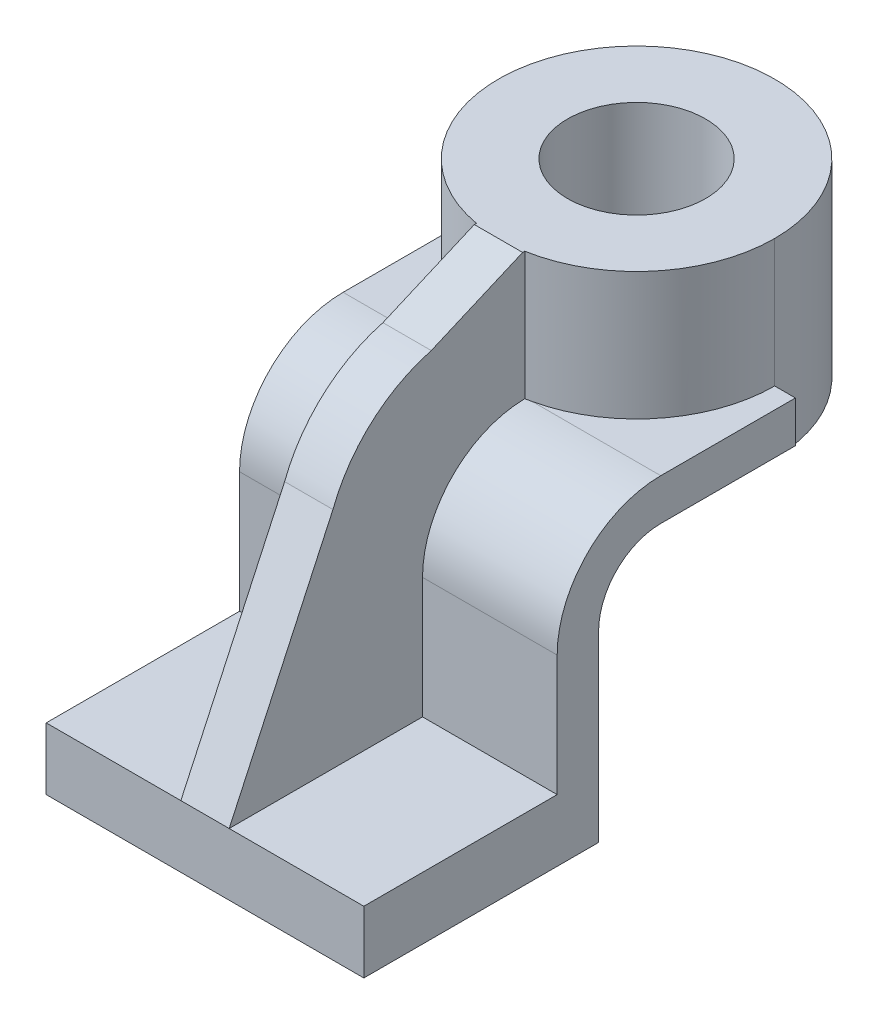
from build123d import *

# Parameters (mm, degrees)
SKETCH1_W                = 92
SKETCH1_H                = 68
BOSS_EXTRUDE1_DEPTH      = 18
BOSS_EXTRUDE2_DEPTH      = 92
BOSS_EXTRUDE3_DEPTH      = 37
BOSS_EXTRUDE3_DEPTH_BACK = 18
SKETCH3_R                = 40
SKETCH3_R_2              = 20
SKETCH3_2_R              = 20
CUT_EXTRUDE1_DEPTH       = 18
BOSS_EXTRUDE6_DEPTH      = 7


with BuildPart() as part:
    # Sketch1 → Boss-Extrude1 (new body)
    with BuildSketch(Plane(origin=(0, 0, 0), x_dir=(1, 0, 0), z_dir=(0, 1, 0))):
        Rectangle(SKETCH1_W, SKETCH1_H)
    extrude(amount=BOSS_EXTRUDE1_DEPTH)

    # Sketch2 → Boss-Extrude2 (add)
    with BuildSketch(Plane(origin=(46, 0, 0), x_dir=(0, 0, -1), z_dir=(1, 0, 0))):
        with BuildLine():
            Line((34, 18), (34, 53))
            ThreePointArc((34, 53), (39.272077939, 65.727922061), (52, 71))
            Line((52, 71), (91, 71))
            Line((91, 71), (91, 83))
            Line((91, 83), (52, 83))
            ThreePointArc((52, 83), (30.786796564, 74.213203436), (22, 53))
            Line((22, 53), (22, 18))
            Line((22, 18), (34, 18))
        make_face()
    extrude(amount=-BOSS_EXTRUDE2_DEPTH)

    # Sketch3 → Boss-Extrude3 (add, two sides: drawn at the far end of the back side and taken through both)
    with BuildSketch(Plane(origin=(0, 83, 0), x_dir=(1, 0, 0), z_dir=(0, 1, 0)).offset(-BOSS_EXTRUDE3_DEPTH_BACK)):
        with Locations((0, 91)):
            Circle(SKETCH3_R)
        with Locations((0, 91)):
            Circle(SKETCH3_R_2, mode=Mode.SUBTRACT)
    extrude(amount=BOSS_EXTRUDE3_DEPTH + BOSS_EXTRUDE3_DEPTH_BACK)

    # Sketch3<2> → Cut-Extrude1 (cut)
    with BuildSketch(Plane(origin=(0, 83, 0), x_dir=(1, 0, 0), z_dir=(0, 1, 0))):
        with Locations((0, 91)):
            Circle(SKETCH3_2_R)
    extrude(amount=-CUT_EXTRUDE1_DEPTH, mode=Mode.SUBTRACT)

    # Sketch4 → Boss-Extrude6 (add, symmetric)
    with BuildSketch(Plane(origin=(0, 0, 0), x_dir=(0, 0, -1), z_dir=(1, 0, 0))):
        with BuildLine():
            Line((-34, 18), (22, 18))
            Line((22, 18), (22, 53))
            ThreePointArc((22, 53), (30.436141347, 73.856653615), (51, 82.983328701))
            Line((51, 82.983328701), (56, 82.983328701))
            Line((56, 82.983328701), (56, 120))
            Line((56, 120), (51, 120))
            Line((51, 120), (24.532733424, 108.624093987))
            ThreePointArc((24.532733424, 108.624093987), (7.198339235, 99.241076962), (-3.946518406, 82.983328701))
            Line((-3.946518406, 82.983328701), (-34, 18))
        make_face()
    extrude(amount=BOSS_EXTRUDE6_DEPTH, both=True)


solid = part.part
